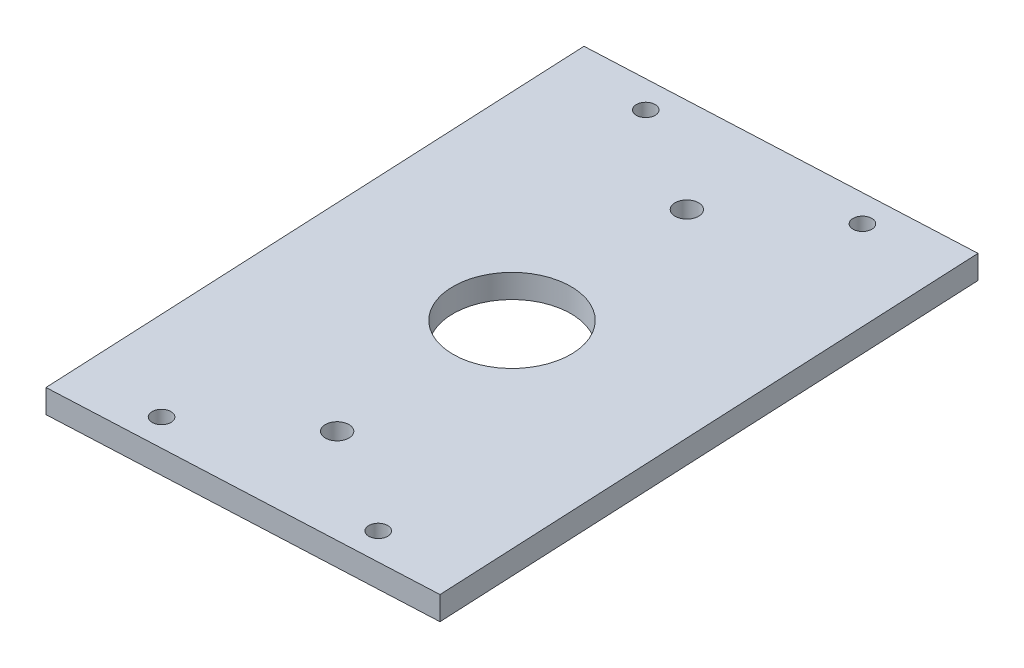
from build123d import *

# Parameters (mm, degrees)
SKETCH_1_W      = 80
SKETCH_1_H      = 120
SKETCH_1_R      = 2.5
SKETCH_1_R_2    = 2
SKETCH_1_R_3    = 12.5
EXTRUDE_1_DEPTH = 5


with BuildPart() as part:
    # 草图1 → 凸台-拉伸1 (new body)
    with BuildSketch(Plane(origin=(-72.587068572, 0, 457.027671738), x_dir=(0.9989001630901289, 0, -0.04688778282787646), z_dir=(0, 1, 0))):
        with Locations((93.936248853, 453.121569129)):
            Rectangle(SKETCH_1_W, SKETCH_1_H)
        with Locations((93.936248853, 492.121569129)):
            Circle(SKETCH_1_R, mode=Mode.SUBTRACT)
        with Locations((93.936248853, 414.121569129)):
            Circle(SKETCH_1_R, mode=Mode.SUBTRACT)
        with Locations((115.936248853, 507.121569129)):
            Circle(SKETCH_1_R_2, mode=Mode.SUBTRACT)
        with Locations((115.936248853, 399.121569129)):
            Circle(SKETCH_1_R_2, mode=Mode.SUBTRACT)
        with Locations((71.936248853, 507.121569129)):
            Circle(SKETCH_1_R_2, mode=Mode.SUBTRACT)
        with Locations((71.936248853, 399.121569129)):
            Circle(SKETCH_1_R_2, mode=Mode.SUBTRACT)
        with Locations((93.936248853, 453.121569129)):
            Circle(SKETCH_1_R_3, mode=Mode.SUBTRACT)
    extrude(amount=EXTRUDE_1_DEPTH)


solid = part.part
